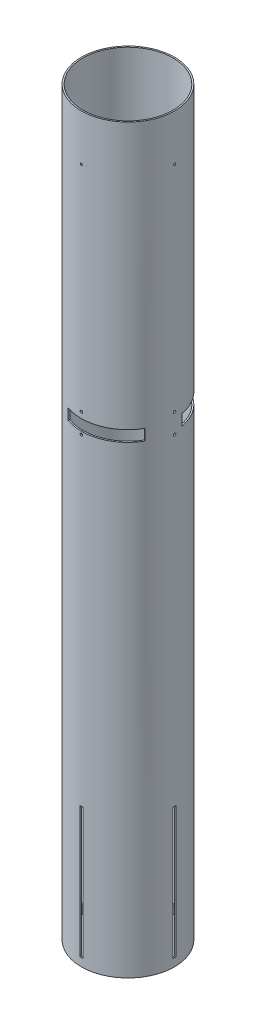
from build123d import *

# Parameters (mm, degrees)
SKETCH1_R              = 51.1048
SKETCH1_R_2            = 49.53
BOSS_EXTRUDE1_DEPTH    = 812.8
CUT_EXTRUDE1_DEPTH     = 817.00688794
CIRPATTERN1_COUNT      = 4
CUT_EXTRUDE2_DEPTH     = 817.00688794
CIRPATTERN2_COUNT      = 4
SKETCH3_R              = 3.175
CUT_EXTRUDE3_DEPTH     = 817.006888053
CUT_EXTRUDE4_START     = 508.635
CUT_EXTRUDE4_DEPTH     = 12.065
CIRPATTERN3_COUNT      = 3
LPATTERN1_COPY_1_DEPTH = 817.00688794
LPATTERN1_COPY_2_DEPTH = 817.00688794
LPATTERN1_COPY_3_DEPTH = 817.00688794
LPATTERN1_COPY_4_DEPTH = 817.00688794
SKETCH8_R              = 1.0922
CUT_EXTRUDE5_DEPTH     = 817.006888053
CIRPATTERN4_COUNT      = 4
SKETCH18_W             = 6.54812
SKETCH18_H             = 51.1048


with BuildPart() as part:
    # Sketch1 → Boss-Extrude1 (new body)
    with BuildSketch(Plane(origin=(0, 0, 0), x_dir=(1, 0, 0), z_dir=(0, 1, 0))):
        Circle(SKETCH1_R)
        Circle(SKETCH1_R_2, mode=Mode.SUBTRACT)
    extrude(amount=BOSS_EXTRUDE1_DEPTH)

    # Sketch2 → Cut-Extrude1 (cut, through all)
    with BuildSketch(Plane(origin=(0, 0, 0), x_dir=(0, 0, -1), z_dir=(1, 0, 0))):
        Polygon((0, 8.89), (1.5875, 8.89), (1.5875, 152.4), (-1.5875, 152.4), (-1.5875, 8.89), align=None)
    cut_extrude1 = extrude(amount=-CUT_EXTRUDE1_DEPTH, mode=Mode.SUBTRACT)

    # CirPattern1: Cut-Extrude1 ×4 about axis
    cirpattern1_axis = Axis((0, 0, 0), (0, 1, 0))
    for i in range(1, CIRPATTERN1_COUNT):
        add(cut_extrude1.rotate(cirpattern1_axis, i * 360 / CIRPATTERN1_COUNT), mode=Mode.SUBTRACT)

    # Sketch2<3> → Cut-Extrude2 (cut, through all)
    with BuildSketch(Plane(origin=(0, 0, 0), x_dir=(0, 0, -1), z_dir=(1, 0, 0))):
        with BuildLine():
            ThreePointArc((0, 528.40255), (-0.956397277, 526.093602723), (1.35255, 527.05))
            ThreePointArc((1.35255, 527.05), (0.956397277, 528.006397277), (0, 528.40255))
        make_face()
    cut_extrude2 = extrude(amount=-CUT_EXTRUDE2_DEPTH, mode=Mode.SUBTRACT)

    # CirPattern2: Cut-Extrude2 ×4 about axis
    cirpattern2_axis = Axis((0, 812.8, 0), (0, -1, 0))
    for i in range(1, CIRPATTERN2_COUNT):
        add(cut_extrude2.rotate(cirpattern2_axis, i * 360 / CIRPATTERN2_COUNT), mode=Mode.SUBTRACT)

    # Sketch3 → Cut-Extrude3 (cut, through all)
    with BuildSketch(Plane(origin=(0, 0, 0), x_dir=(0.7071067811865477, 0, -0.7071067811865475), z_dir=(0.7071067811865475, 0, 0.7071067811865477))):
        with Locations((0, 127)):
            Circle(SKETCH3_R)
    extrude(amount=-CUT_EXTRUDE3_DEPTH, mode=Mode.SUBTRACT)

    # Sketch7 → Cut-Extrude4 (cut)
    with BuildSketch(Plane(origin=(0, 0, 0), x_dir=(1, 0, 0), z_dir=(0, 1, 0)).offset(CUT_EXTRUDE4_START)):
        with BuildLine():
            Line((-44.258055055, -25.5524), (-42.894238249, -24.765))
            ThreePointArc((-42.894238249, -24.765), (-48.777528007, 8.60079424), (-31.837270308, 37.942181268))
            Line((-31.837270308, 37.942181268), (-32.849532236, 39.148548057))
            ThreePointArc((-32.849532236, 39.148548057), (-46.026790738, 22.208897258), (-51.086898433, 1.35255))
            ThreePointArc((-51.086898433, 1.35255), (-51.1048, 0), (-51.086898433, -1.35255))
            ThreePointArc((-51.086898433, -1.35255), (-49.184074902, -13.87902587), (-44.258055055, -25.5524))
        make_face()
    cut_extrude4 = extrude(amount=CUT_EXTRUDE4_DEPTH, mode=Mode.SUBTRACT)

    # CirPattern3: Cut-Extrude4 ×3 about axis
    cirpattern3_axis = Axis((0, 812.8, 0), (0, -1, 0))
    for i in range(1, CIRPATTERN3_COUNT):
        add(cut_extrude4.rotate(cirpattern3_axis, i * 360 / CIRPATTERN3_COUNT), mode=Mode.SUBTRACT)

    # LPattern1 copy 1 sketch → LPattern1 copy 1 (cut, through all)
    with BuildSketch(Plane(origin=(0, -21.6916, 0), x_dir=(1, 0, 0), z_dir=(0, 0, 1))):
        with BuildLine():
            ThreePointArc((0, 528.40255), (-0.956397277, 526.093602723), (1.35255, 527.05))
            ThreePointArc((1.35255, 527.05), (0.956397277, 528.006397277), (0, 528.40255))
        make_face()
    extrude(amount=-LPATTERN1_COPY_1_DEPTH, mode=Mode.SUBTRACT)

    # LPattern1 copy 2 sketch → LPattern1 copy 2 (cut, through all)
    with BuildSketch(Plane(origin=(0, -21.6916, 0), x_dir=(0, 0, 1), z_dir=(-1, 0, 0))):
        with BuildLine():
            ThreePointArc((0, 528.40255), (-0.956397277, 526.093602723), (1.35255, 527.05))
            ThreePointArc((1.35255, 527.05), (0.956397277, 528.006397277), (0, 528.40255))
        make_face()
    extrude(amount=-LPATTERN1_COPY_2_DEPTH, mode=Mode.SUBTRACT)

    # LPattern1 copy 3 sketch → LPattern1 copy 3 (cut, through all)
    with BuildSketch(Plane(origin=(0, -21.6916, 0), x_dir=(-1, 0, 0), z_dir=(0, 0, -1))):
        with BuildLine():
            ThreePointArc((0, 528.40255), (-0.956397277, 526.093602723), (1.35255, 527.05))
            ThreePointArc((1.35255, 527.05), (0.956397277, 528.006397277), (0, 528.40255))
        make_face()
    extrude(amount=-LPATTERN1_COPY_3_DEPTH, mode=Mode.SUBTRACT)

    # LPattern1 copy 4 sketch → LPattern1 copy 4 (cut, through all)
    with BuildSketch(Plane(origin=(0, -21.6916, 0), x_dir=(0, 0, -1), z_dir=(1, 0, 0))):
        with BuildLine():
            ThreePointArc((0, 528.40255), (-0.956397277, 526.093602723), (1.35255, 527.05))
            ThreePointArc((1.35255, 527.05), (0.956397277, 528.006397277), (0, 528.40255))
        make_face()
    extrude(amount=-LPATTERN1_COPY_4_DEPTH, mode=Mode.SUBTRACT)

    # Sketch8 → Cut-Extrude5 (cut, through all)
    with BuildSketch(Plane.XY):
        with Locations((0, 762)):
            Circle(SKETCH8_R)
    cut_extrude5 = extrude(amount=-CUT_EXTRUDE5_DEPTH, mode=Mode.SUBTRACT)

    # CirPattern4: Cut-Extrude5 ×4 about axis
    cirpattern4_axis = Axis((0, 812.8, 0), (0, -1, 0))
    for i in range(1, CIRPATTERN4_COUNT):
        add(cut_extrude5.rotate(cirpattern4_axis, i * 360 / CIRPATTERN4_COUNT), mode=Mode.SUBTRACT)

    # Sketch18 → 1/2 Clearance Hole4 (revolve, cut)
    with BuildSketch(Plane(origin=(0, 752.856, 0), x_dir=(0, -1, 0), z_dir=(1, 0, 0))):
        with Locations((3.27406, 25.5524)):
            Rectangle(SKETCH18_W, SKETCH18_H)
    revolve(axis=Axis((0, 752.856, 6.35), (0, 0, -1)), mode=Mode.SUBTRACT)


solid = part.part
